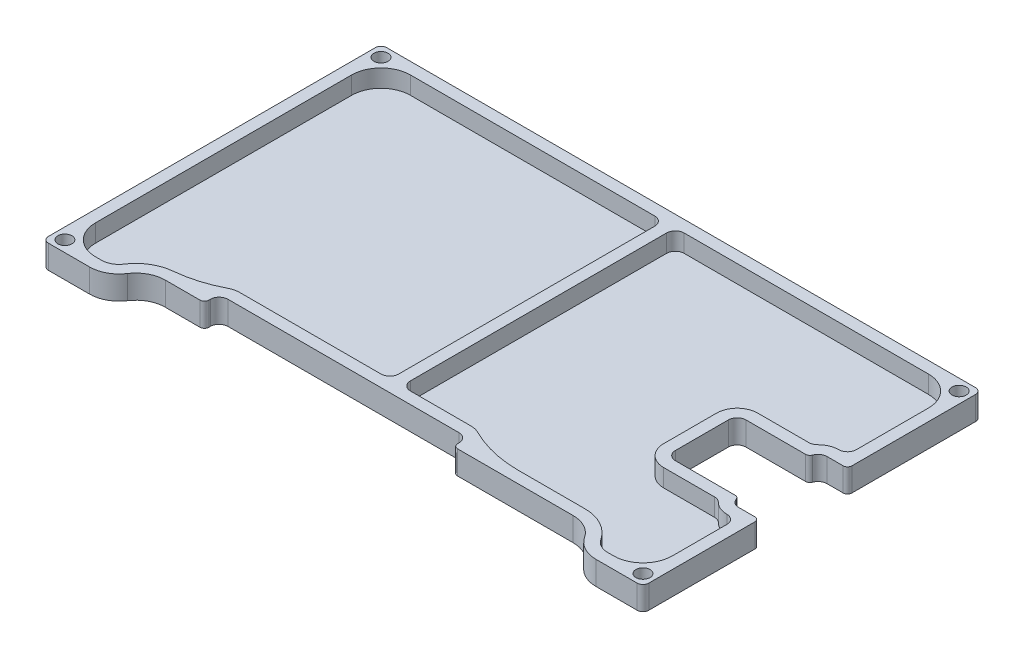
from build123d import *

# Parameters (mm, degrees)
SKIZZE1_W                       = 102
SKIZZE1_H                       = 57.5
AUFSATZ_LINEAR_AUSTRAGEN1_DEPTH = 1
VERRUNDUNG1_R                   = 1
SCHNITT_LINEAR_AUSTRAGEN1_REACH = 60.554
SCHNITT_LINEAR_AUSTRAGEN2_REACH = 60.554
SKIZZE6_W                       = 42.25
SKIZZE6_H                       = 2.5
VERRUNDUNG2_R                   = 1.5
VERRUNDUNG3_R                   = 0.75
AUFSATZ_LINEAR_START            = 3
AUFSATZ_LINEAR_AUSTRAGEN2_DEPTH = 3
VERRUNDUNG4_R                   = 5
DURCHGANGSLOCH_F_R_M21_D        = 2.4
VERRUNDUNG5_R                   = 1.5
VERRUNDUNG6_R                   = 20


with BuildPart() as part:
    # Skizze1 → Aufsatz-Linear austragen1 (new body)
    with BuildSketch(Plane(origin=(0, 0, 0), x_dir=(1, 0, 0), z_dir=(0, 1, 0))):
        Rectangle(SKIZZE1_W, SKIZZE1_H)
    extrude(amount=AUFSATZ_LINEAR_AUSTRAGEN1_DEPTH)

    # Verrundung1
    verrundung1_edges = [part.edges().sort_by_distance(p)[0] for p in [
        (51, 0.5, 28.75),
        (-51, 0.5, 28.75),
        (-51, 0.5, -28.75),
        (51, 0.5, -28.75),
    ]]
    fillet(verrundung1_edges, radius=VERRUNDUNG1_R)

    # Skizze5 → Schnitt-Linear austragen1 (cut, up to next)
    with BuildSketch(Plane(origin=(0, 1, 0), x_dir=(1, 0, 0), z_dir=(0, 1, 0)), mode=Mode.PRIVATE) as schnitt_linear_austragen1_sk1:
        with BuildLine():
            Line((-43, -28.75), (43, -28.75))
            ThreePointArc((43, -28.75), (40.628291755, -28.151704215), (38.824176728, -26.5))
            ThreePointArc((38.824176728, -26.5), (37.020061701, -24.848295785), (34.648353456, -24.25))
            Line((34.648353456, -24.25), (-34.648353456, -24.25))
            ThreePointArc((-34.648353456, -24.25), (-37.020061701, -24.848295785), (-38.824176728, -26.5))
            ThreePointArc((-38.824176728, -26.5), (-40.628291755, -28.151704215), (-43, -28.75))
        make_face()
    schnitt_linear_austragen1_tool1 = extrude(schnitt_linear_austragen1_sk1.sketch, amount=-SCHNITT_LINEAR_AUSTRAGEN1_REACH, mode=Mode.PRIVATE) & part.part
    add(schnitt_linear_austragen1_tool1.solids().sort_by_distance((0, 1, 26.551349))[0], mode=Mode.SUBTRACT)

    # Skizze6 → Schnitt-Linear austragen2 (cut, up to next)
    with BuildSketch(Plane(origin=(0, 1, 0), x_dir=(1, 0, 0), z_dir=(0, 1, 0)), mode=Mode.PRIVATE) as schnitt_linear_austragen2_sk1:
        with Locations((-6.875, -23)):
            Rectangle(SKIZZE6_W, SKIZZE6_H)
    schnitt_linear_austragen2_tool1 = extrude(schnitt_linear_austragen2_sk1.sketch, amount=-SCHNITT_LINEAR_AUSTRAGEN2_REACH, mode=Mode.PRIVATE) & part.part
    # Skizze6 → Schnitt-Linear austragen2 (cut, up to next)
    with BuildSketch(Plane(origin=(0, 1, 0), x_dir=(1, 0, 0), z_dir=(0, 1, 0)), mode=Mode.PRIVATE) as schnitt_linear_austragen2_sk2:
        Polygon((33.75, 4.5), (46, 4.5), (46, 6), (51, 6), (51, 4.5), (51, -7.5), (51, -9), (46, -9), (46, -7.5), (33.75, -7.5), align=None)
    schnitt_linear_austragen2_tool2 = extrude(schnitt_linear_austragen2_sk2.sketch, amount=-SCHNITT_LINEAR_AUSTRAGEN2_REACH, mode=Mode.PRIVATE) & part.part
    add(schnitt_linear_austragen2_tool1.solids().sort_by_distance((-6.875, 1, 23))[0], mode=Mode.SUBTRACT)
    add(schnitt_linear_austragen2_tool2.solids().sort_by_distance((42.788851, 1, 1.5))[0], mode=Mode.SUBTRACT)

    # Verrundung2
    verrundung2_edges = [part.edges().sort_by_distance(p)[0] for p in [
        (33.75, 0.5, -4.5),
        (33.75, 0.5, 7.5),
        (14.25, 0.5, 21.75),
        (-28, 0.5, 21.75),
        (46, 0.5, -6),
        (46, 0.5, 9),
    ]]
    fillet(verrundung2_edges, radius=VERRUNDUNG2_R - 0.0001)  # a hair under: the kernel refuses the full size

    # Verrundung3
    verrundung3_edges = [part.edges().sort_by_distance(p)[0] for p in [
        (14.25, 0.5, 24.25),
        (-28, 0.5, 24.25),
        (46, 0.5, -4.5),
        (51, 0.5, -6),
        (51, 0.5, 9),
        (46, 0.5, 7.5),
    ]]
    fillet(verrundung3_edges, radius=VERRUNDUNG3_R)

    # Skizze8 → Aufsatz-Linear austragen2 (add)
    with BuildSketch(Plane(origin=(0, 1, 0), x_dir=(1, 0, 0), z_dir=(0, 1, 0)).offset(AUFSATZ_LINEAR_START)):
        with BuildLine():
            Line((35.25, 4.5), (45.378679656, 4.5))
            ThreePointArc((45.378679656, 4.5), (45.811692358, 4.637627564), (46.085786438, 5))
            ThreePointArc((46.085786438, 5), (46.633974596, 5.724744871), (47.5, 6))
            Line((47.5, 6), (50.25, 6))
            ThreePointArc((50.25, 6), (50.780330086, 6.219669914), (51, 6.75))
            Line((51, 6.75), (51, 27.75))
            ThreePointArc((51, 27.75), (50.707106781, 28.457106781), (50, 28.75))
            Line((50, 28.75), (-50, 28.75))
            ThreePointArc((-50, 28.75), (-50.707106781, 28.457106781), (-51, 27.75))
            Line((-51, 27.75), (-51, -27.75))
            ThreePointArc((-51, -27.75), (-50.707106781, -28.457106781), (-50, -28.75))
            Line((-50, -28.75), (-43, -28.75))
            ThreePointArc((-43, -28.75), (-40.628291755, -28.151704215), (-38.824176728, -26.5))
            ThreePointArc((-38.824176728, -26.5), (-37.020061701, -24.848295785), (-34.648353456, -24.25))
            Line((-34.648353456, -24.25), (-28.75, -24.25))
            ThreePointArc((-28.75, -24.25), (-28.219669914, -24.030330086), (-28, -23.5))
            Line((-28, -23.5), (-28, -23.25))
            ThreePointArc((-28, -23.25), (-27.560660172, -22.189339828), (-26.5, -21.75))
            Line((-26.5, -21.75), (12.75, -21.75))
            ThreePointArc((12.75, -21.75), (13.810660172, -22.189339828), (14.25, -23.25))
            Line((14.25, -23.25), (14.25, -23.5))
            ThreePointArc((14.25, -23.5), (14.469669914, -24.030330086), (15, -24.25))
            Line((15, -24.25), (34.648353456, -24.25))
            ThreePointArc((34.648353456, -24.25), (37.020061701, -24.848295785), (38.824176728, -26.5))
            ThreePointArc((38.824176728, -26.5), (40.628291755, -28.151704215), (43, -28.75))
            Line((43, -28.75), (50, -28.75))
            ThreePointArc((50, -28.75), (50.707106781, -28.457106781), (51, -27.75))
            Line((51, -27.75), (51, -9.75))
            ThreePointArc((51, -9.75), (50.780330086, -9.219669914), (50.25, -9))
            Line((50.25, -9), (47.5, -9))
            ThreePointArc((47.5, -9), (46.633974596, -8.724744871), (46.085786438, -8))
            ThreePointArc((46.085786438, -8), (45.811692358, -7.637627564), (45.378679656, -7.5))
            Line((45.378679656, -7.5), (35.25, -7.5))
            ThreePointArc((35.25, -7.5), (34.189339828, -7.060660172), (33.75, -6))
            Line((33.75, -6), (33.75, 3))
            ThreePointArc((33.75, 3), (34.189339828, 4.060660172), (35.25, 4.5))
        make_face()
        with BuildLine():
            Line((35.25, 6.5), (44.627718677, 6.5))
            ThreePointArc((44.627718677, 6.5), (45.879814825, 7.602418411), (47.5, 8))
            Line((47.5, 8), (49, 8))
            Line((49, 8), (49, 26.75))
            Line((49, 26.75), (1, 26.75))
            Line((1, 26.75), (1, -19.75))
            Line((1, -19.75), (12.75, -19.75))
            ThreePointArc((12.75, -19.75), (14.841650066, -20.44375696), (16.104101966, -22.25))
            Line((16.104101966, -22.25), (34.648353456, -22.25))
            ThreePointArc((34.648353456, -22.25), (37.968744999, -23.087614098), (40.494506037, -25.4))
            ThreePointArc((40.494506037, -25.4), (41.576975053, -26.391022529), (43, -26.75))
            Line((43, -26.75), (49, -26.75))
            Line((49, -26.75), (49, -11))
            Line((49, -11), (47.5, -11))
            ThreePointArc((47.5, -11), (45.879814825, -10.602418411), (44.627718677, -9.5))
            Line((44.627718677, -9.5), (35.25, -9.5))
            ThreePointArc((35.25, -9.5), (32.775126266, -8.474873734), (31.75, -6))
            Line((31.75, -6), (31.75, 3))
            ThreePointArc((31.75, 3), (32.775126266, 5.474873734), (35.25, 6.5))
        make_face(mode=Mode.SUBTRACT)
        with BuildLine():
            Line((-49, 26.75), (-49, -26.75))
            Line((-49, -26.75), (-43, -26.75))
            ThreePointArc((-43, -26.75), (-41.576975053, -26.391022529), (-40.494506037, -25.4))
            ThreePointArc((-40.494506037, -25.4), (-37.968744999, -23.087614098), (-34.648353456, -22.25))
            Line((-34.648353456, -22.25), (-29.854101966, -22.25))
            ThreePointArc((-29.854101966, -22.25), (-28.591650066, -20.44375696), (-26.5, -19.75))
            Line((-26.5, -19.75), (-1, -19.75))
            Line((-1, -19.75), (-1, 26.75))
            Line((-1, 26.75), (-49, 26.75))
        make_face(mode=Mode.SUBTRACT)
    extrude(amount=-AUFSATZ_LINEAR_AUSTRAGEN2_DEPTH)

    # Verrundung4
    verrundung4_edges = [part.edges().sort_by_distance(p)[0] for p in [
        (49, 2.5, -26.75),
        (49, 2.5, 26.75),
        (-49, 2.5, 26.75),
        (-49, 2.5, -26.75),
    ]]
    fillet(verrundung4_edges, radius=VERRUNDUNG4_R)

    # Durchgangsloch für M21 (through all)
    with Locations(Plane(origin=(0, 0, 0), x_dir=(-1, 0, 0), z_dir=(0, -1, 0))):
        with Locations((-49.1, -26.85), (49.1, 26.85), (49.1, -26.85), (-49.1, 26.85)):
            Hole(DURCHGANGSLOCH_F_R_M21_D / 2)

    # Verrundung5
    verrundung5_edges = [part.edges().sort_by_distance(p)[0] for p in [
        (-1, 2.5, -26.75),
        (-1, 2.5, 19.75),
        (1, 2.5, 19.75),
        (1, 2.5, -26.75),
        (49, 2.5, -8),
        (44.627718677, 2.5, -6.5),
        (44.627718677, 2.5, 9.5),
        (49, 2.5, 11),
    ]]
    fillet(verrundung5_edges, radius=VERRUNDUNG5_R - 0.0001)  # a hair under: the kernel refuses the full size

    # Verrundung6
    verrundung6_edges = [part.edges().sort_by_distance(p)[0] for p in [
        (16.104101966, 2.5, 22.25),
        (-29.854101966, 2.5, 22.25),
    ]]
    fillet(verrundung6_edges, radius=VERRUNDUNG6_R)


solid = part.part
